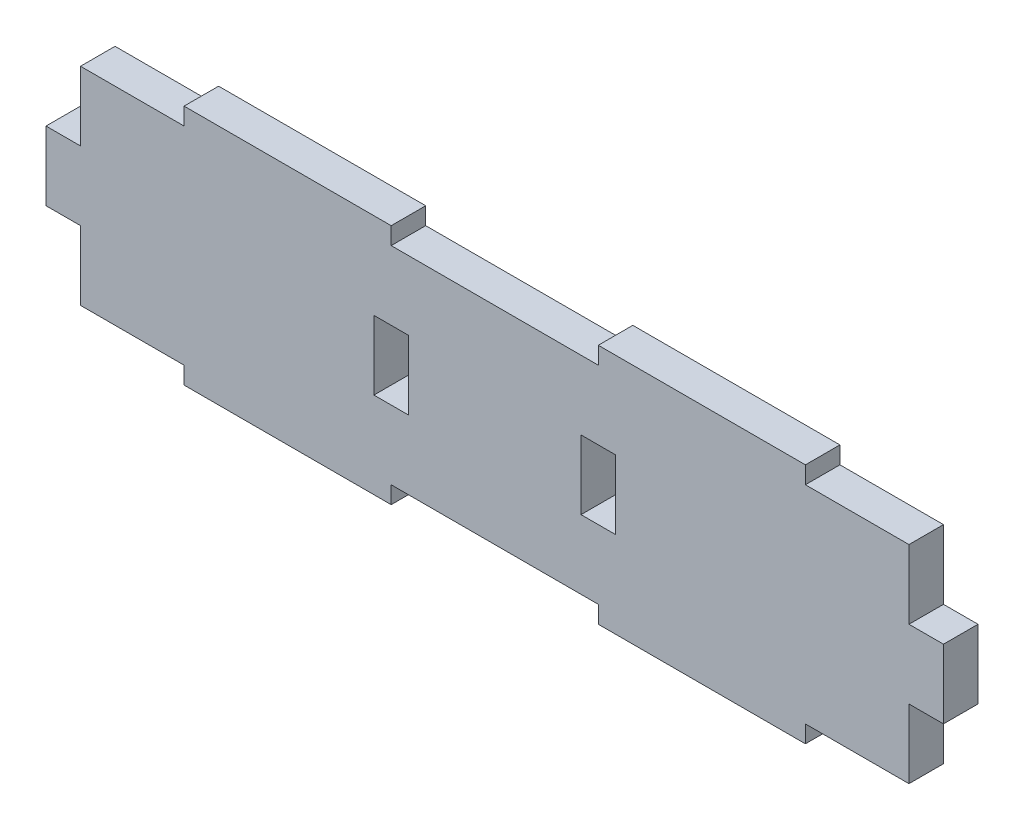
from build123d import *

# Parameters (mm, degrees)
SKETCH1_W           = 330.2
SKETCH1_H           = 76.2
BOSS_EXTRUDE1_DEPTH = 12.7
SKETCH2_W           = 76.2
SKETCH2_H           = 6.35
BOSS_EXTRUDE2_DEPTH = 12.7
SKETCH3_W           = 12.7
SKETCH3_H           = 25.4
CUT_EXTRUDE1_DEPTH  = 172.45


with BuildPart() as part:
    # Sketch1 → Boss-Extrude1 (new body)
    with BuildSketch(Plane.XY):
        Rectangle(SKETCH1_W, SKETCH1_H)
    extrude(amount=BOSS_EXTRUDE1_DEPTH)

    # Sketch2 → Boss-Extrude2 (add)
    with BuildSketch(Plane.XY.offset(12.7)):
        with Locations((-76.2, -41.275)):
            Rectangle(SKETCH2_W, SKETCH2_H)
        with Locations((76.2, -41.275)):
            Rectangle(SKETCH2_W, SKETCH2_H)
        with Locations((76.2, 41.275)):
            Rectangle(SKETCH2_W, SKETCH2_H)
        with Locations((-76.2, 41.275)):
            Rectangle(SKETCH2_W, SKETCH2_H)
    extrude(amount=-BOSS_EXTRUDE2_DEPTH)

    # Sketch3 → Cut-Extrude1 (cut, through all)
    with BuildSketch(Plane.XY.offset(12.7)):
        with Locations((-158.75, -25.4)):
            Rectangle(SKETCH3_W, SKETCH3_H)
        with Locations((-158.75, 25.4)):
            Rectangle(SKETCH3_W, SKETCH3_H)
        with Locations((158.75, 25.4)):
            Rectangle(SKETCH3_W, SKETCH3_H)
        with Locations((158.75, -25.4)):
            Rectangle(SKETCH3_W, SKETCH3_H)
        with Locations((38.1, 0)):
            Rectangle(SKETCH3_W, SKETCH3_H)
        with Locations((-38.1, 0)):
            Rectangle(SKETCH3_W, SKETCH3_H)
    extrude(amount=-CUT_EXTRUDE1_DEPTH, mode=Mode.SUBTRACT)


solid = part.part
